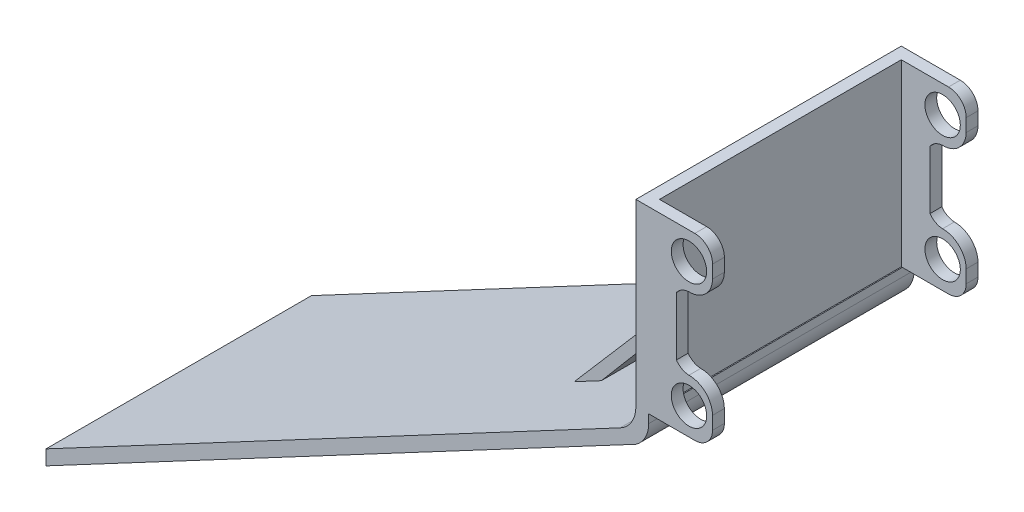
from build123d import *

# Parameters (mm, degrees)
ESQUISSE1_W         = 41
ESQUISSE1_H         = 30.4
BOSS_EXTRU_1_DEPTH  = 2
ESQUISSE3_R         = 3
BOSS_EXTRU_2_DEPTH  = 2
ESQUISSE4_W         = 15
ESQUISSE4_H         = 15.4
BOSS_EXTRU_3_DEPTH  = 2.5
BOSS_EXTRU_9_DEPTH  = 45
BOSS_EXTRU_10_DEPTH = 15
ESQUISSE13_W        = 2.172512758
ESQUISSE13_H        = 5.56
BOSS_EXTRU_11_DEPTH = 45
CONG_2_R            = 5
CONG_3_R            = 5
CONG_4_R            = 5


with BuildPart() as part:
    # Esquisse1 → Boss.-Extru.1 (new body)
    with BuildSketch(Plane(origin=(0, 0, 0), x_dir=(0, 0, -1), z_dir=(1, 0, 0))):
        with Locations((0, -15.2)):
            Rectangle(ESQUISSE1_W, ESQUISSE1_H)
    extrude(amount=BOSS_EXTRU_1_DEPTH)

    # Esquisse3 → Boss.-Extru.2 (add)
    with BuildSketch(Plane.XY.offset(20.5)):
        with BuildLine():
            Line((0, 0), (0, -30.4))
            Line((0, -30.4), (10, -30.4))
            ThreePointArc((10, -30.4), (12.121320344, -29.521320344), (13, -27.4))
            Line((13, -27.4), (13, -25.203998005))
            ThreePointArc((13, -25.203998005), (11.799859401, -22.431518929), (8.989283799, -21.323528643))
            ThreePointArc((8.989283799, -21.323528643), (7.793527962, -20.98117775), (6.868390743, -20.149819053))
            Line((6.868390743, -20.149819053), (6.868390743, -10.250180947))
            ThreePointArc((6.868390743, -10.250180947), (7.793527962, -9.41882225), (8.989283799, -9.076471357))
            ThreePointArc((8.989283799, -9.076471357), (11.799859401, -7.968481071), (13, -5.196001995))
            Line((13, -5.196001995), (13, -3))
            ThreePointArc((13, -3), (12.121320344, -0.878679656), (10, 0))
            Line((10, 0), (0, 0))
        make_face()
        with Locations((9, -4.61)):
            Circle(ESQUISSE3_R, mode=Mode.SUBTRACT)
        with Locations(Location((9, -25.79, 0), (0, 0, 180))):
            Circle(ESQUISSE3_R, mode=Mode.SUBTRACT)
    boss_extru_2 = extrude(amount=BOSS_EXTRU_2_DEPTH)

    # Symétrie1: Boss.-Extru.2 across plane
    add(boss_extru_2.mirror(Plane.XY))

    # Esquisse4 → Boss.-Extru.3 (add)
    with BuildSketch(Plane.ZY):
        with Locations((0, -15.2)):
            Rectangle(ESQUISSE4_W, ESQUISSE4_H)
    extrude(amount=BOSS_EXTRU_3_DEPTH)



with BuildPart() as body_2:
    # Esquisse11 → Boss.-Extru.9 (new body)
    with BuildSketch(Plane(origin=(0, 0, -22.5), x_dir=(-1, 0, 0), z_dir=(0, 0, -1))):
        Polygon((100, -86.630943166), (100, -89.130943166), (0, -35.96), (0, -33.46), align=None)
    extrude(amount=-BOSS_EXTRU_9_DEPTH)


with BuildPart() as part_1:
    add(part.part)

    add(body_2.part)  # Boss.-Extru.10 merges body 2
    # Esquisse12 → Boss.-Extru.10 (add)
    with BuildSketch(Plane(origin=(0, 0, -7.5), x_dir=(-1, 0, 0), z_dir=(0, 0, -1))):
        Polygon((2.5, -22.9), (20.844614881, -44.543278331), (25.445497181, -46.989610844), (2.5, -20.4), align=None)
    extrude(amount=-BOSS_EXTRU_10_DEPTH)

    # Esquisse13 → Boss.-Extru.11 (add)
    with BuildSketch(Plane(origin=(0, 0, -22.5), x_dir=(-1, 0, 0), z_dir=(0, 0, -1))):
        with Locations((-1.086256379, -33.18)):
            Rectangle(ESQUISSE13_W, ESQUISSE13_H)
    extrude(amount=-BOSS_EXTRU_11_DEPTH)

    # Congé2
    # the kernel refuses this fillet: 5 mm, written as the material it takes off along each edge
    with BuildSketch(Plane(origin=(2.172512758, -35.96, -32.809375556), x_dir=(0, 1, 0), z_dir=(0, 0, 1))) as cong_2_piece_1:
        with BuildLine():
            CenterArc((4.123750222, 5), CONG_2_R, 214.436842146, 55.563157854)
            Line((0, 2.172512758), (-0.082475004, 2.115963013))
            ThreePointArc((-0.082475004, 2.115963013), (-0.1, 1.086256379), (-0.1, 0))
            Line((-0.1, 0), (0, -0.1))
            Line((0, -0.1), (4.123750222, -0.1))
            Line((4.123750222, -0.1), (4.123750222, 0))
        make_face()
    extrude(amount=65.618751112, mode=Mode.SUBTRACT)

    # Congé3
    cong_3_edges = [part_1.edges().sort_by_distance(p)[0] for p in [
        (0, -33.46, 0),
    ]]
    fillet(cong_3_edges, radius=CONG_3_R)

    # Congé4
    # the kernel refuses this fillet: 5 mm, written as the material it adds along each edge
    with BuildSketch(Plane(origin=(-2.5, -20.4, -7.5), x_dir=(-0.6533220619728018, -0.7570801036479604, 0), z_dir=(0, 0, 1))) as cong_4_piece_1:
        with BuildLine():
            CenterArc((CONG_4_R * 0.3718225826, -CONG_4_R), CONG_4_R, 90, 40.792541927)
            Line((-CONG_4_R * 0.281499479373, -CONG_4_R * 0.242919896352), (0, 0))
            Line((0, 0), (CONG_4_R * 0.3718225826, 0))
        make_face()
    extrude(amount=15)
    # the kernel refuses this fillet: 5 mm, written as the material it takes off along each edge
    with BuildSketch(Plane(origin=(-2.5, -7.5, -18.325317547), x_dir=(1, 0, 0), z_dir=(0, 0, 1))) as cong_4_2_piece_1:
        with BuildLine():
            CenterArc((5, -4.330127019), CONG_4_R, 120, 60)
            Line((0, -4.330127019), (0, 0))
            Line((0, 0), (2.5, 0))
        make_face()
    extrude(amount=36.650635095, mode=Mode.SUBTRACT)


solid = part_1.part
